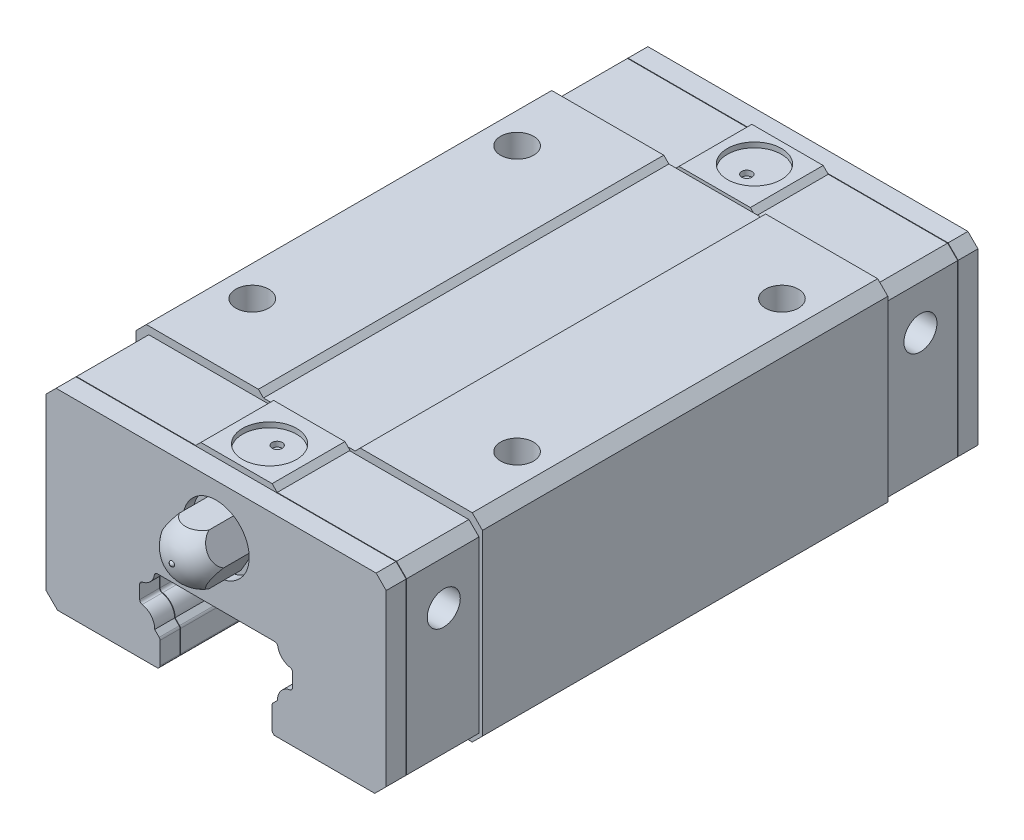
from build123d import *

# Parameters (mm, degrees)
BOSS_EXTRUDE1_DEPTH = 58.1
SKETCH2_R           = 1.5
BOSS_EXTRUDE2_DEPTH = 58.1
FILLET1_R           = 0.3
FILLET2_R           = 0.3
CUT_EXTRUDE1_DEPTH  = 9.15
CUT_EXTRUDE2_DEPTH  = 54.078738681
CUT_EXTRUDE3_DEPTH  = 54.078738681
SKETCH6_W           = 8
SKETCH6_H           = 7.15
BOSS_EXTRUDE3_DEPTH = 0.5
CHAMFER1_SIZE       = 0.5
CUT_EXTRUDE4_DEPTH  = 54.078738681
SKETCH8_R           = 2.65
CUT_EXTRUDE5_DEPTH  = 0.5
SKETCH9_R           = 0.5
CUT_EXTRUDE6_DEPTH  = 0.5
TAP1_D              = 3.242
TAP1_DEPTH          = 6
TAP1_TIP            = 0.973995063
TAP2_D              = 3.242
TAP2_DEPTH          = 4.5
TAP2_TIP            = 0.973995063
TAP3_D              = 3.242
TAP3_DEPTH          = 4.5
TAP3_TIP            = 0.973995063
SKETCH17_R          = 3.25
CUT_EXTRUDE8_DEPTH  = 1
BOSS_EXTRUDE4_DEPTH = 5.34
CUT_EXTRUDE9_START  = -1
SKETCH21_R          = 3.25
CUT_EXTRUDE9_DEPTH  = 1
SKETCH22_R          = 2.75
BOSS_EXTRUDE5_DEPTH = 2.2
CUT_EXTRUDE10_DEPTH = 1.4
FILLET3_R           = 1.3
CUT_EXTRUDE11_START = 0.05
CUT_EXTRUDE11_DEPTH = 0.05
CUT_EXTRUDE12_START = 0.05
CUT_EXTRUDE12_DEPTH = 0.05


with BuildPart() as part:
    # Sketch1 → Boss-Extrude1 (new body)
    with BuildSketch(Plane.XY):
        Polygon((-5.7, -8), (-5.5, -7.8), (-5.5, -5.4), (-7.5, -5.4), (-7.5, 0), (7.5, 0), (7.5, -5.4), (5.5, -5.4), (5.5, -7.8), (5.7, -8), (16, -8), (17, -7), (17, 10.5), (16, 11.5), (-16, 11.5), (-17, 10.5), (-17, -7), (-16, -8), align=None)
    extrude(amount=-BOSS_EXTRUDE1_DEPTH)

    # Sketch2 → Boss-Extrude2 (add, through all)
    with BuildSketch(Plane.XY):
        with Locations((-7.53, 0.03)):
            Circle(SKETCH2_R)
        with Locations((7.53, 0.03)):
            Circle(SKETCH2_R)
        with BuildLine():
            Line((-5.5, -5.4), (-6.030519656, -4.869480344))
            ThreePointArc((-6.030519656, -4.869480344), (-8.576608686, -3.755472077), (-7.53, -6.33))
            Line((-7.53, -6.33), (-5.5, -6.33))
            Line((-5.5, -6.33), (-5.5, -5.4))
        make_face()
        with BuildLine():
            Line((5.5, -5.4), (6.030519656, -4.869480344))
            ThreePointArc((6.030519656, -4.869480344), (8.576608686, -3.755472077), (7.53, -6.33))
            Line((7.53, -6.33), (5.5, -6.33))
            Line((5.5, -6.33), (5.5, -5.4))
        make_face()
    extrude(amount=-BOSS_EXTRUDE2_DEPTH)

    # Fillet1
    fillet1_edges = [part.edges().sort_by_distance(p)[0] for p in [
        (-6.03030003, 0, -29.05),
        (-7.5, -1.46969997, -29.05),
        (7.5, -1.46969997, -29.05),
        (6.03030003, 0, -29.05),
        (-7.5, -3.33030003, -29.05),
        (7.5, -3.33030003, -29.05),
    ]]
    fillet(fillet1_edges, radius=FILLET1_R)

    # Fillet2
    fillet2_edges = [part.edges().sort_by_distance(p)[0] for p in [
        (-5.5, -7.8, -29.05),
        (5.5, -7.8, -29.05),
        (5.5, -5.4, -29.05),
        (-5.5, -5.4, -29.05),
    ]]
    fillet(fillet2_edges, radius=FILLET2_R)

    # Sketch3 → Cut-Extrude1 (cut)
    with BuildSketch(Plane.XY):
        Polygon((15.710050506, 10.8), (16.7, 9.810050506), (16.7, -6.875735931), (15.575735931, -8), (16, -8), (17, -7), (17, 10.5), (16, 11.5), (-16, 11.5), (-17, 10.5), (-17, -7), (-16, -8), (-15.575735931, -8), (-16.7, -6.875735931), (-16.7, 9.810050506), (-15.710050506, 10.8), align=None)
    extrude(amount=-CUT_EXTRUDE1_DEPTH, mode=Mode.SUBTRACT)

    # Sketch4 → Cut-Extrude2 (cut, through all)
    with BuildSketch(Plane.XY.offset(-48.95)):
        Polygon((-16, -8), (-15.575735931, -8), (-16.7, -6.875735931), (-16.7, 9.810050506), (-15.710050506, 10.8), (15.710050506, 10.8), (16.7, 9.810050506), (16.7, -6.875735931), (15.575735931, -8), (16, -8), (17, -7), (17, 10.5), (16, 11.5), (-16, 11.5), (-17, 10.5), (-17, -7), align=None)
    extrude(amount=-CUT_EXTRUDE2_DEPTH, mode=Mode.SUBTRACT)

    # Sketch5 → Cut-Extrude3 (cut, through all)
    with BuildSketch(Plane.XY.offset(-9.15)):
        Polygon((-4.5, 11), (4.5, 11), (5, 11.5), (-5, 11.5), align=None)
    extrude(amount=-CUT_EXTRUDE3_DEPTH, mode=Mode.SUBTRACT)

    # Sketch6 → Boss-Extrude3 (add)
    with BuildSketch(Plane(origin=(0, 10.8, 0), x_dir=(1, 0, 0), z_dir=(0, 1, 0))):
        with Locations((0, 52.525)):
            Rectangle(SKETCH6_W, SKETCH6_H)
        with Locations((0, 5.575)):
            Rectangle(SKETCH6_W, SKETCH6_H)
    extrude(amount=BOSS_EXTRUDE3_DEPTH)

    # Chamfer1
    # the kernel refuses this chamfer: 0.5 mm, written as the material it takes off along each edge
    with BuildSketch(Plane(origin=(4, 11.3, -9.15), x_dir=(0.027495876610585647, -0.9996219169112968, 0), z_dir=(0, 0, 1)), Plane(origin=(-4, 11.3, -0.714158506), x_dir=(-0.027495876610585647, -0.9996219169112968, 0), z_dir=(0, 0, -1)), Plane(origin=(4, 11.3, -57.385841494), x_dir=(0.027495876610585647, -0.9996219169112968, 0), z_dir=(0, 0, 1)), Plane(origin=(-4, 11.3, -48.95), x_dir=(-0.02749587661058651, -0.9996219169112968, 0), z_dir=(0, 0, -1))) as chamfer1_piece_1:
        Polygon((CHAMFER1_SIZE * 0.999621916911, -CHAMFER1_SIZE * 0.0274958766106), (-CHAMFER1_SIZE * 0.0274958766106, -CHAMFER1_SIZE * 0.999621916911), (0, 0), align=None)
    extrude(amount=8.435841494, mode=Mode.SUBTRACT)

    # Sketch7 → Cut-Extrude4 (cut, through all)
    with BuildSketch(Plane(origin=(0, 0, -48.95), x_dir=(-1, 0, 0), z_dir=(0, 0, -1))):
        Polygon((15.575735931, -8), (16, -8), (17, -7), (17, 5.5), (16.7, 5.2), (16.7, -6.875735931), align=None)
    extrude(amount=-CUT_EXTRUDE4_DEPTH, mode=Mode.SUBTRACT)

    # Sketch8 → Cut-Extrude5 (cut)
    with BuildSketch(Plane(origin=(0, 11.3, 0), x_dir=(1, 0, 0), z_dir=(0, 1, 0))):
        with Locations(Location((0, 52.85, 0), (0, 0, 270))):
            Circle(SKETCH8_R)
        with Locations(Location((0, 5.25, 0), (0, 0, 270))):
            Circle(SKETCH8_R)
    extrude(amount=-CUT_EXTRUDE5_DEPTH, mode=Mode.SUBTRACT)

    # Sketch9 → Cut-Extrude6 (cut)
    with BuildSketch(Plane(origin=(0, 10.8, 0), x_dir=(1, 0, 0), z_dir=(0, 1, 0))):
        with Locations(Location((0, 6, 0), (0, 0, 270))):
            Circle(SKETCH9_R)
        with Locations(Location((0, 52.1, 0), (0, 0, 270))):
            Circle(SKETCH9_R)
    extrude(amount=-CUT_EXTRUDE6_DEPTH, mode=Mode.SUBTRACT)

    # Tap1
    with Locations(Plane(origin=(0, 11.5, 0), x_dir=(1, 0, 0), z_dir=(0, 1, 0))):
        with Locations((-13, 42.55), (13, 42.55), (13, 16.55), (-13, 16.55)):
            Hole(TAP1_D / 2, depth=TAP1_DEPTH)
            with Locations((0, 0, -(TAP1_DEPTH + TAP1_TIP / 2))):  # 118° drill point
                Cone(0, TAP1_D / 2, TAP1_TIP, mode=Mode.SUBTRACT)

    # Tap2
    with Locations(Plane(origin=(16.7, 0, 0), x_dir=(0, 0, -1), z_dir=(1, 0, 0))):
        with Locations((5.65, 5.5), (52.45, 5.5)):
            Hole(TAP2_D / 2, depth=TAP2_DEPTH)
            with Locations((0, 0, -(TAP2_DEPTH + TAP2_TIP / 2))):  # 118° drill point
                Cone(0, TAP2_D / 2, TAP2_TIP, mode=Mode.SUBTRACT)

    # Tap3
    with Locations(Plane.ZY.offset(16.7)):
        with Locations((-52.45, 5.5), (-5.65, 5.5)):
            Hole(TAP3_D / 2, depth=TAP3_DEPTH)
            with Locations((0, 0, -(TAP3_DEPTH + TAP3_TIP / 2))):  # 118° drill point
                Cone(0, TAP3_D / 2, TAP3_TIP, mode=Mode.SUBTRACT)

    # Sketch17 → Cut-Extrude8 (cut)
    with BuildSketch(Plane.XY):
        with Locations((0, 5.9)):
            Circle(SKETCH17_R)
    extrude(amount=-CUT_EXTRUDE8_DEPTH, mode=Mode.SUBTRACT)

    # Sketch18 → Boss-Extrude4 (add)
    with BuildSketch(Plane.XY.offset(-1)):
        Polygon((1.443375673, 8.4), (-1.443375673, 8.4), (-2.886751346, 5.9), (-1.443375673, 3.4), (1.443375673, 3.4), (2.886751346, 5.9), align=None)
    extrude(amount=BOSS_EXTRUDE4_DEPTH)

    # Sketch19 → Cut-Revolve1 (revolve, cut)
    with BuildSketch(Plane(origin=(0, 0, 0), x_dir=(0, 0, -1), z_dir=(1, 0, 0))):
        with BuildLine():
            Line((-4.44, 8.9), (-4.44, 5.9))
            Line((-4.44, 5.9), (-4.34, 5.9))
            ThreePointArc((-4.34, 5.9), (-3.461320344, 8.021320344), (-1.34, 8.9))
            Line((-1.34, 8.9), (-4.44, 8.9))
        make_face()
    revolve(axis=Axis((0, 5.9, 0), (0, 0, 1)), mode=Mode.SUBTRACT)

    # Sketch20 → Revolve1 (revolve)
    with BuildSketch(Plane(origin=(0, 0, 0), x_dir=(0, 0, -1), z_dir=(1, 0, 0))):
        with BuildLine():
            Line((-3.94, 5.9), (-4.5, 5.9))
            ThreePointArc((-4.5, 5.9), (-4.22, 6.18), (-3.94, 5.9))
        make_face()
    revolve(axis=Axis((0, 5.9, 0), (0, 0, 1)))

    # Sketch21 → Cut-Extrude9 (cut)
    with BuildSketch(Plane(origin=(0, 0, -58.1), x_dir=(-1, 0, 0), z_dir=(0, 0, -1)).offset(CUT_EXTRUDE9_START)):
        with Locations(Location((0, 5.9, 0), (0, 0, 180))):
            Circle(SKETCH21_R)
    extrude(amount=CUT_EXTRUDE9_DEPTH, mode=Mode.SUBTRACT)

    # Sketch22 → Boss-Extrude5 (add)
    with BuildSketch(Plane(origin=(0, 0, -57.1), x_dir=(-1, 0, 0), z_dir=(0, 0, -1))):
        with Locations((0, 5.9)):
            Circle(SKETCH22_R)
    extrude(amount=BOSS_EXTRUDE5_DEPTH)

    # Sketch23 → Cut-Extrude10 (cut)
    with BuildSketch(Plane(origin=(0, 0, -59.3), x_dir=(-1, 0, 0), z_dir=(0, 0, -1))):
        Polygon((0.721687836, 7.15), (-0.721687836, 7.15), (-1.443375673, 5.9), (-0.721687836, 4.65), (0.721687836, 4.65), (1.443375673, 5.9), align=None)
    extrude(amount=-CUT_EXTRUDE10_DEPTH, mode=Mode.SUBTRACT)

    # Fillet3
    fillet3_edges = [part.edges().sort_by_distance(p)[0] for p in [
        (2.75, 5.9, -59.3),
    ]]
    fillet(fillet3_edges, radius=FILLET3_R)

    # Sketch24 → Cut-Extrude11 (cut)
    with BuildSketch(Plane.XY.offset(-2).offset(CUT_EXTRUDE11_START)):
        with BuildLine():
            Line((15.575735931, -8), (16.7, -6.875735931))
            Line((16.7, -6.875735931), (16.7, 9.810050506))
            Line((16.7, 9.810050506), (15.710050506, 10.8))
            Line((15.710050506, 10.8), (-15.710050506, 10.8))
            Line((-15.710050506, 10.8), (-16.7, 9.810050506))
            Line((-16.7, 9.810050506), (-16.7, -6.875735931))
            Line((-16.7, -6.875735931), (-15.575735931, -8))
            Line((-15.575735931, -8), (-5.7, -8))
            Line((-5.7, -8), (-5.587867966, -7.887867966))
            ThreePointArc((-5.587867966, -7.887867966), (-5.52283614, -7.790540961), (-5.5, -7.675735931))
            Line((-5.5, -7.675735931), (-5.5, -5.524264069))
            ThreePointArc((-5.5, -5.524264069), (-5.52283614, -5.409459039), (-5.587867966, -5.312132034))
            Line((-5.587867966, -5.312132034), (-6.030519656, -4.869480344))
            ThreePointArc((-6.030519656, -4.869480344), (-6.363686605, -3.886753975), (-7.255, -3.35542379))
            ThreePointArc((-7.255, -3.35542379), (-7.430759615, -3.252211443), (-7.5, -3.060508548))
            Line((-7.5, -3.060508548), (-7.5, -1.739491452))
            ThreePointArc((-7.5, -1.739491452), (-7.430759615, -1.547788557), (-7.255, -1.44457621))
            ThreePointArc((-7.255, -1.44457621), (-6.469339828, -1.030660172), (-6.05542379, -0.245))
            ThreePointArc((-6.05542379, -0.245), (-5.952211443, -0.069240385), (-5.760508548, 0))
            Line((-5.760508548, 0), (5.760508548, 0))
            ThreePointArc((5.760508548, 0), (5.952211443, -0.069240385), (6.05542379, -0.245))
            ThreePointArc((6.05542379, -0.245), (6.469339828, -1.030660172), (7.255, -1.44457621))
            ThreePointArc((7.255, -1.44457621), (7.430759615, -1.547788557), (7.5, -1.739491452))
            Line((7.5, -1.739491452), (7.5, -3.060508548))
            ThreePointArc((7.5, -3.060508548), (7.430759615, -3.252211443), (7.255, -3.35542379))
            ThreePointArc((7.255, -3.35542379), (6.363686605, -3.886753975), (6.030519656, -4.869480344))
            Line((6.030519656, -4.869480344), (5.587867966, -5.312132034))
            ThreePointArc((5.587867966, -5.312132034), (5.52283614, -5.409459039), (5.5, -5.524264069))
            Line((5.5, -5.524264069), (5.5, -7.675735931))
            ThreePointArc((5.5, -7.675735931), (5.52283614, -7.790540961), (5.587867966, -7.887867966))
            Line((5.587867966, -7.887867966), (5.7, -8))
            Line((5.7, -8), (15.575735931, -8))
        make_face()
        with BuildLine():
            Line((15.555025253, -7.95), (16.65, -6.855025253))
            Line((16.65, -6.855025253), (16.65, 9.789339828))
            Line((16.65, 9.789339828), (15.689339828, 10.75))
            Line((15.689339828, 10.75), (-15.689339828, 10.75))
            Line((-15.689339828, 10.75), (-16.65, 9.789339828))
            Line((-16.65, 9.789339828), (-16.65, -6.855025253))
            Line((-16.65, -6.855025253), (-15.555025253, -7.95))
            Line((-15.555025253, -7.95), (-5.720710678, -7.95))
            Line((-5.720710678, -7.95), (-5.623223305, -7.852512627))
            ThreePointArc((-5.623223305, -7.852512627), (-5.569030117, -7.771406789), (-5.55, -7.675735931))
            Line((-5.55, -7.675735931), (-5.55, -5.524264069))
            ThreePointArc((-5.55, -5.524264069), (-5.569030117, -5.428593211), (-5.623223305, -5.347487373))
            Line((-5.623223305, -5.347487373), (-6.081220872, -4.889489807))
            ThreePointArc((-6.081220872, -4.889489807), (-6.395885375, -3.926515624), (-7.264166667, -3.40457633))
            ThreePointArc((-7.264166667, -3.40457633), (-7.469219551, -3.284161925), (-7.55, -3.060508548))
            Line((-7.55, -3.060508548), (-7.55, -1.739491452))
            ThreePointArc((-7.55, -1.739491452), (-7.469219551, -1.515838075), (-7.264166667, -1.39542367))
            ThreePointArc((-7.264166667, -1.39542367), (-6.504695167, -0.995304833), (-6.10457633, -0.235833333))
            ThreePointArc((-6.10457633, -0.235833333), (-5.984161925, -0.030780449), (-5.760508548, 0.05))
            Line((-5.760508548, 0.05), (5.760508548, 0.05))
            ThreePointArc((5.760508548, 0.05), (5.984161925, -0.030780449), (6.10457633, -0.235833333))
            ThreePointArc((6.10457633, -0.235833333), (6.504695167, -0.995304833), (7.264166667, -1.39542367))
            ThreePointArc((7.264166667, -1.39542367), (7.469219551, -1.515838075), (7.55, -1.739491452))
            Line((7.55, -1.739491452), (7.55, -3.060508548))
            ThreePointArc((7.55, -3.060508548), (7.469219551, -3.284161925), (7.264166667, -3.40457633))
            ThreePointArc((7.264166667, -3.40457633), (6.395885375, -3.926515624), (6.081220872, -4.889489807))
            Line((6.081220872, -4.889489807), (5.623223305, -5.347487373))
            ThreePointArc((5.623223305, -5.347487373), (5.569030117, -5.428593211), (5.55, -5.524264069))
            Line((5.55, -5.524264069), (5.55, -7.675735931))
            ThreePointArc((5.55, -7.675735931), (5.569030117, -7.771406789), (5.623223305, -7.852512627))
            Line((5.623223305, -7.852512627), (5.720710678, -7.95))
            Line((5.720710678, -7.95), (15.555025253, -7.95))
        make_face(mode=Mode.SUBTRACT)
    cut_extrude11 = extrude(amount=-CUT_EXTRUDE11_DEPTH, mode=Mode.SUBTRACT)

    # Sketch25 → Cut-Extrude12 (cut)
    with BuildSketch(Plane.XY.offset(-9.15).offset(CUT_EXTRUDE12_START)):
        with BuildLine():
            Line((15.575735931, -8), (16.7, -6.875735931))
            Line((16.7, -6.875735931), (16.7, 9.810050506))
            Line((16.7, 9.810050506), (15.710050506, 10.8))
            Line((15.710050506, 10.8), (-15.710050506, 10.8))
            Line((-15.710050506, 10.8), (-16.7, 9.810050506))
            Line((-16.7, 9.810050506), (-16.7, -6.875735931))
            Line((-16.7, -6.875735931), (-15.575735931, -8))
            Line((-15.575735931, -8), (-5.7, -8))
            Line((-5.7, -8), (-5.587867966, -7.887867966))
            ThreePointArc((-5.587867966, -7.887867966), (-5.52283614, -7.790540961), (-5.5, -7.675735931))
            Line((-5.5, -7.675735931), (-5.5, -5.524264069))
            ThreePointArc((-5.5, -5.524264069), (-5.52283614, -5.409459039), (-5.587867966, -5.312132034))
            Line((-5.587867966, -5.312132034), (-6.030519656, -4.869480344))
            ThreePointArc((-6.030519656, -4.869480344), (-6.363686605, -3.886753975), (-7.255, -3.35542379))
            ThreePointArc((-7.255, -3.35542379), (-7.430759615, -3.252211443), (-7.5, -3.060508548))
            Line((-7.5, -3.060508548), (-7.5, -1.739491452))
            ThreePointArc((-7.5, -1.739491452), (-7.430759615, -1.547788557), (-7.255, -1.44457621))
            ThreePointArc((-7.255, -1.44457621), (-6.469339828, -1.030660172), (-6.05542379, -0.245))
            ThreePointArc((-6.05542379, -0.245), (-5.952211443, -0.069240385), (-5.760508548, 0))
            Line((-5.760508548, 0), (5.760508548, 0))
            ThreePointArc((5.760508548, 0), (5.952211443, -0.069240385), (6.05542379, -0.245))
            ThreePointArc((6.05542379, -0.245), (6.469339828, -1.030660172), (7.255, -1.44457621))
            ThreePointArc((7.255, -1.44457621), (7.430759615, -1.547788557), (7.5, -1.739491452))
            Line((7.5, -1.739491452), (7.5, -3.060508548))
            ThreePointArc((7.5, -3.060508548), (7.430759615, -3.252211443), (7.255, -3.35542379))
            ThreePointArc((7.255, -3.35542379), (6.363686605, -3.886753975), (6.030519656, -4.869480344))
            Line((6.030519656, -4.869480344), (5.587867966, -5.312132034))
            ThreePointArc((5.587867966, -5.312132034), (5.52283614, -5.409459039), (5.5, -5.524264069))
            Line((5.5, -5.524264069), (5.5, -7.675735931))
            ThreePointArc((5.5, -7.675735931), (5.52283614, -7.790540961), (5.587867966, -7.887867966))
            Line((5.587867966, -7.887867966), (5.7, -8))
            Line((5.7, -8), (15.575735931, -8))
        make_face()
        with BuildLine():
            Line((15.555025253, -7.95), (16.65, -6.855025253))
            Line((16.65, -6.855025253), (16.65, 9.789339828))
            Line((16.65, 9.789339828), (15.689339828, 10.75))
            Line((15.689339828, 10.75), (-15.689339828, 10.75))
            Line((-15.689339828, 10.75), (-16.65, 9.789339828))
            Line((-16.65, 9.789339828), (-16.65, -6.855025253))
            Line((-16.65, -6.855025253), (-15.555025253, -7.95))
            Line((-15.555025253, -7.95), (-5.720710678, -7.95))
            Line((-5.720710678, -7.95), (-5.623223305, -7.852512627))
            ThreePointArc((-5.623223305, -7.852512627), (-5.569030117, -7.771406789), (-5.55, -7.675735931))
            Line((-5.55, -7.675735931), (-5.55, -5.524264069))
            ThreePointArc((-5.55, -5.524264069), (-5.569030117, -5.428593211), (-5.623223305, -5.347487373))
            Line((-5.623223305, -5.347487373), (-6.081220872, -4.889489807))
            ThreePointArc((-6.081220872, -4.889489807), (-6.395885375, -3.926515624), (-7.264166667, -3.40457633))
            ThreePointArc((-7.264166667, -3.40457633), (-7.469219551, -3.284161925), (-7.55, -3.060508548))
            Line((-7.55, -3.060508548), (-7.55, -1.739491452))
            ThreePointArc((-7.55, -1.739491452), (-7.469219551, -1.515838075), (-7.264166667, -1.39542367))
            ThreePointArc((-7.264166667, -1.39542367), (-6.504695167, -0.995304833), (-6.10457633, -0.235833333))
            ThreePointArc((-6.10457633, -0.235833333), (-5.984161925, -0.030780449), (-5.760508548, 0.05))
            Line((-5.760508548, 0.05), (5.760508548, 0.05))
            ThreePointArc((5.760508548, 0.05), (5.984161925, -0.030780449), (6.10457633, -0.235833333))
            ThreePointArc((6.10457633, -0.235833333), (6.504695167, -0.995304833), (7.264166667, -1.39542367))
            ThreePointArc((7.264166667, -1.39542367), (7.469219551, -1.515838075), (7.55, -1.739491452))
            Line((7.55, -1.739491452), (7.55, -3.060508548))
            ThreePointArc((7.55, -3.060508548), (7.469219551, -3.284161925), (7.264166667, -3.40457633))
            ThreePointArc((7.264166667, -3.40457633), (6.395885375, -3.926515624), (6.081220872, -4.889489807))
            Line((6.081220872, -4.889489807), (5.623223305, -5.347487373))
            ThreePointArc((5.623223305, -5.347487373), (5.569030117, -5.428593211), (5.55, -5.524264069))
            Line((5.55, -5.524264069), (5.55, -7.675735931))
            ThreePointArc((5.55, -7.675735931), (5.569030117, -7.771406789), (5.623223305, -7.852512627))
            Line((5.623223305, -7.852512627), (5.720710678, -7.95))
            Line((5.720710678, -7.95), (15.555025253, -7.95))
        make_face(mode=Mode.SUBTRACT)
    cut_extrude12 = extrude(amount=-CUT_EXTRUDE12_DEPTH, mode=Mode.SUBTRACT)

    # Mirror1: Cut-Extrude11, Cut-Extrude12 across plane
    add(cut_extrude11.mirror(Plane.XY.offset(-29.05)), mode=Mode.SUBTRACT)
    add(cut_extrude12.mirror(Plane.XY.offset(-29.05)), mode=Mode.SUBTRACT)


solid = part.part
